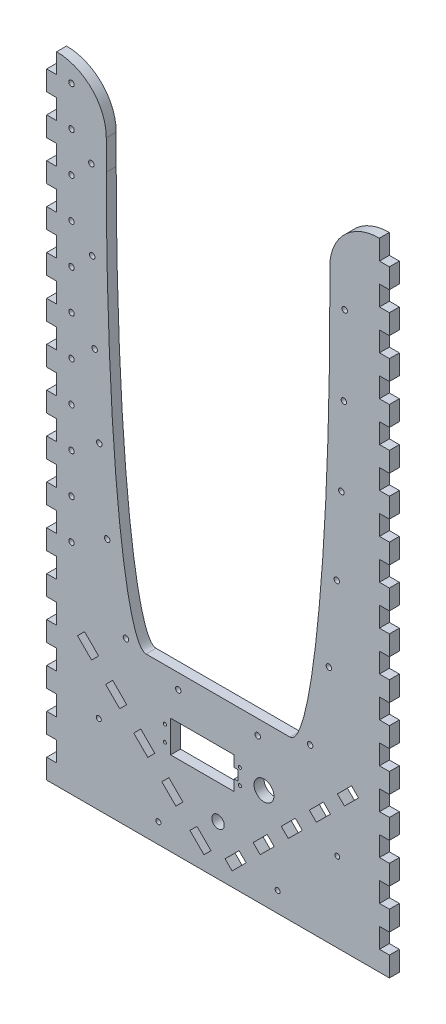
from build123d import *

# Parameters (mm, degrees)
BOSS_EXTRUDE1_DEPTH   = 6.35
SKETCH2_R             = 3.96875
SKETCH2_R_2           = 1.5875
CUT_EXTRUDE1_DEPTH    = 462.730590415
BOSS_EXTRUDE2_DEPTH   = 6.35
FILLET1_R             = 31.75
SKETCH5_R             = 1
SKETCH5_W             = 40.64
SKETCH5_H             = 20.32
CUT_EXTRUDE2_DEPTH    = 462.730590552
SKETCH6_W             = 6.35
SKETCH6_H             = 12.7
CUT_EXTRUDE3_DEPTH    = 462.730590552
LPATTERN1_COUNT       = 16
LPATTERN1_PITCH       = 25.4
SKETCH7_R             = 1.75
CUT_EXTRUDE4_DEPTH    = 462.730590552
CRVPATTERN3_OUTLINE_R = 1.75
CRVPATTERN3_DEPTH     = 6.35
SKETCH9_R             = 1.75
CUT_EXTRUDE5_DEPTH    = 462.730590552
CUT_EXTRUDE6_DEPTH    = 462.730590552
LPATTERN2_COUNT       = 5
LPATTERN2_PITCH       = 25.4
CUT_EXTRUDE7_DEPTH    = 462.730590552
LPATTERN3_COUNT       = 5
LPATTERN3_PITCH       = 25.4
SKETCH13_R            = 1.5875
CUT_EXTRUDE8_DEPTH    = 462.730590552
SKETCH14_R            = 6.35
CUT_EXTRUDE9_DEPTH    = 462.730590552
SKETCH15_R            = 1.75
CUT_EXTRUDE10_DEPTH   = 462.730590552
LPATTERN4_COUNT       = 11
LPATTERN4_PITCH       = 25.4
SKETCH16_W            = 2.54
SKETCH16_H            = 6.35
CUT_EXTRUDE11_DEPTH   = 462.730590552


# Read off the part's stored shape, not the designer's step: CrvPattern3
with BuildPart() as part:
    # Sketch1 → Boss-Extrude1 (new body)
    with BuildSketch(Plane.XY):
        Polygon((0, 406.4), (0, 0), (219.075, 0), (219.075, 406.4), (180.975, 406.4), (180.975, 101.6), (38.1, 101.6), (38.1, 406.4), align=None)
    extrude(amount=BOSS_EXTRUDE1_DEPTH)

    # Sketch2 → Cut-Extrude1 (cut, through all)
    with BuildSketch(Plane.XY.offset(6.35)):
        with Locations((109.5375, 31.75)):
            Circle(SKETCH2_R)
        with Locations((71.4375, 12.7)):
            Circle(SKETCH2_R_2)
        with Locations((147.6375, 12.7)):
            Circle(SKETCH2_R_2)
    extrude(amount=-CUT_EXTRUDE1_DEPTH, mode=Mode.SUBTRACT)

    # Sketch4 → Boss-Extrude2 (add, through all)
    with BuildSketch(Plane.XY.offset(6.35)):
        with BuildLine():
            Line((38.1, 355.6), (38.1, 101.6))
            Line((38.1, 101.6), (63.5, 101.6))
            add(Edge.make_bspline(
                [(38.1, 355.6), (38.1, 101.6), (63.5, 101.6)],
                knots=[4.71238898, 4.71238898, 4.71238898, 6.283185307, 6.283185307, 6.283185307], degree=2, weights=[1, 0.707106781, 1]))
        make_face()
        with BuildLine():
            Line((180.975, 355.6), (180.975, 101.6))
            Line((180.975, 101.6), (155.575, 101.6))
            add(Edge.make_bspline(
                [(155.575, 101.6), (180.975, 101.6), (180.975, 355.6)],
                knots=[3.141592654, 3.141592654, 3.141592654, 4.71238898, 4.71238898, 4.71238898], degree=2, weights=[1, 0.707106781, 1]))
        make_face()
    extrude(amount=-BOSS_EXTRUDE2_DEPTH)

    # Fillet1
    fillet1_edges = [part.edges().sort_by_distance(p)[0] for p in [
        (38.1, 406.4, 3.175),
        (180.975, 406.4, 3.175),
    ]]
    fillet(fillet1_edges, radius=FILLET1_R)

    # Sketch5 → Cut-Extrude2 (cut, through all)
    with BuildSketch(Plane.XY.offset(6.35)):
        with Locations((75.5375, 68.75)):
            Circle(SKETCH5_R)
        with Locations((75.5375, 58.75)):
            Circle(SKETCH5_R)
        with Locations((123.5375, 68.75)):
            Circle(SKETCH5_R)
        with Locations((123.5375, 58.75)):
            Circle(SKETCH5_R)
        with Locations((99.5375, 63.75)):
            Rectangle(SKETCH5_W, SKETCH5_H)
    extrude(amount=-CUT_EXTRUDE2_DEPTH, mode=Mode.SUBTRACT)

    # Sketch6 → Cut-Extrude3 (cut, through all)
    with BuildSketch(Plane.XY.offset(6.35)):
        with Locations((3.175, 400.05)):
            Rectangle(SKETCH6_W, SKETCH6_H)
        with Locations((215.9, 400.05)):
            Rectangle(SKETCH6_W, SKETCH6_H)
    cut_extrude3 = extrude(amount=-CUT_EXTRUDE3_DEPTH, mode=Mode.SUBTRACT)

    # LPattern1: Cut-Extrude3 ×16
    with Locations(*[(0, -i * LPATTERN1_PITCH, 0) for i in range(1, LPATTERN1_COUNT)]):
        add(cut_extrude3, mode=Mode.SUBTRACT)

    # Sketch7 → Cut-Extrude4 (cut, through all)
    with BuildSketch(Plane.XY.offset(6.35)):
        with Locations((28.575, 355.6)):
            Circle(SKETCH7_R)
    cut_extrude4 = extrude(amount=-CUT_EXTRUDE4_DEPTH, mode=Mode.SUBTRACT)

    # CrvPattern3 outline → CrvPattern3 (cut)
    with BuildSketch(Plane.XY):
        with Locations((29.088113328, 304.803472764)):
            Circle(CRVPATTERN3_OUTLINE_R)
        with Locations((30.694206296, 254.030002215)):
            Circle(CRVPATTERN3_OUTLINE_R)
        with Locations((33.646164376, 203.317879517)):
            Circle(CRVPATTERN3_OUTLINE_R)
        with Locations((38.685113302, 152.775108831)):
            Circle(CRVPATTERN3_OUTLINE_R)
        with Locations((50.68611396, 103.738286233)):
            Circle(CRVPATTERN3_OUTLINE_R)
    crvpattern3 = extrude(amount=CRVPATTERN3_DEPTH, mode=Mode.SUBTRACT)

    # Mirror1: Cut-Extrude4, CrvPattern3 across plane
    add(cut_extrude4.mirror(Plane(origin=(109.5375, 0, 0), x_dir=(0, 0, 1), z_dir=(1, 0, 0))), mode=Mode.SUBTRACT)
    add(crvpattern3.mirror(Plane(origin=(109.5375, 0, 0), x_dir=(0, 0, 1), z_dir=(1, 0, 0))), mode=Mode.SUBTRACT)

    # Sketch9 → Cut-Extrude5 (cut, through all)
    with BuildSketch(Plane.XY.offset(6.35)):
        with Locations((134.9375, 92.075)):
            Circle(SKETCH9_R)
        with Locations((84.1375, 92.075)):
            Circle(SKETCH9_R)
    extrude(amount=-CUT_EXTRUDE5_DEPTH, mode=Mode.SUBTRACT)

    # Sketch10 → Cut-Extrude6 (cut, through all)
    with BuildSketch(Plane(origin=(0, 0, 0), x_dir=(-1, 0, 0), z_dir=(0, 0, -1))):
        Polygon((-199.340061211, 89.802561211), (-190.35980509, 80.82230509), (-185.869677029, 85.31243315), (-194.84993315, 94.292689271), align=None)
    cut_extrude6 = extrude(amount=-CUT_EXTRUDE6_DEPTH, mode=Mode.SUBTRACT)

    # LPattern2: Cut-Extrude6 ×5
    with Locations(*[Vector(-0.7071067811865492, -0.7071067811865458, 0) * (i * LPATTERN2_PITCH) for i in range(1, LPATTERN2_COUNT)]):
        add(cut_extrude6, mode=Mode.SUBTRACT)

    # Sketch11 → Cut-Extrude7 (cut, through all)
    with BuildSketch(Plane(origin=(0, 0, 0), x_dir=(-1, 0, 0), z_dir=(0, 0, -1))):
        Polygon((-19.734938789, 89.802561211), (-28.71519491, 80.82230509), (-33.205322971, 85.31243315), (-24.22506685, 94.292689271), align=None)
    cut_extrude7 = extrude(amount=-CUT_EXTRUDE7_DEPTH, mode=Mode.SUBTRACT)

    # LPattern3: Cut-Extrude7 ×5
    with Locations(*[Vector(0.7071067811865434, -0.7071067811865517, 0) * (i * LPATTERN3_PITCH) for i in range(1, LPATTERN3_COUNT)]):
        add(cut_extrude7, mode=Mode.SUBTRACT)

    # Sketch13 → Cut-Extrude8 (cut, through all)
    with BuildSketch(Plane.XY.offset(6.35)):
        with Locations((33.3375, 50.8)):
            Circle(SKETCH13_R)
        with Locations((185.7375, 50.8)):
            Circle(SKETCH13_R)
    extrude(amount=-CUT_EXTRUDE8_DEPTH, mode=Mode.SUBTRACT)

    # Sketch14 → Cut-Extrude9 (cut, through all)
    with BuildSketch(Plane.XY.offset(6.35)):
        with Locations((138.9075, 63.75)):
            Circle(SKETCH14_R)
    extrude(amount=-CUT_EXTRUDE9_DEPTH, mode=Mode.SUBTRACT)

    # Sketch15 → Cut-Extrude10 (cut, through all)
    with BuildSketch(Plane.XY.offset(6.35)):
        with Locations((15.875, 393.7)):
            Circle(SKETCH15_R)
    cut_extrude10 = extrude(amount=-CUT_EXTRUDE10_DEPTH, mode=Mode.SUBTRACT)

    # LPattern4: Cut-Extrude10 ×11
    with Locations(*[(0, -i * LPATTERN4_PITCH, 0) for i in range(1, LPATTERN4_COUNT)]):
        add(cut_extrude10, mode=Mode.SUBTRACT)

    # Sketch16 → Cut-Extrude11 (cut, through all)
    with BuildSketch(Plane.XY.offset(6.35)):
        with Locations((121.1275, 63.75)):
            Rectangle(SKETCH16_W, SKETCH16_H)
    extrude(amount=-CUT_EXTRUDE11_DEPTH, mode=Mode.SUBTRACT)


solid = part.part
